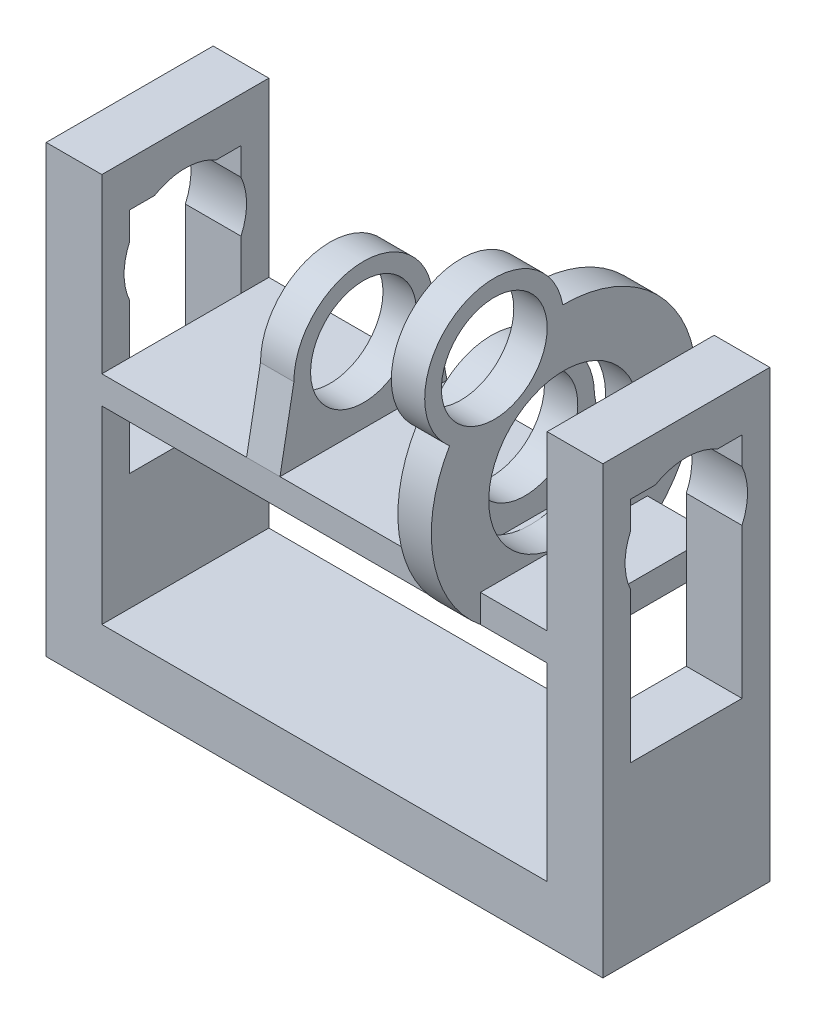
from build123d import *

# Parameters (mm, degrees)
CROQUIS1_W              = 80
CROQUIS1_H              = 34
SALIENTE_EXTRUIR1_DEPTH = 30
CROQUIS2_W              = 20
CROQUIS2_H              = 18
CORTAR_EXTRUIR1_DEPTH   = 30
CORTAR_EXTRUIR2_START   = 100
CROQUIS2_4_R            = 11
CROQUIS2_4_W            = 20
CROQUIS2_4_H            = 41
CORTAR_EXTRUIR2_DEPTH   = 20
SALIENTE_EXTRUIR2_START = 32
SALIENTE_EXTRUIR2_DEPTH = 6
SALIENTE_EXTRUIR3_START = 61
SALIENTE_EXTRUIR3_DEPTH = 6
SALIENTE_EXTRUIR4_START = -28
SALIENTE_EXTRUIR4_DEPTH = 6


# Read off the part's stored shape, not the designer's step: Saliente-Extruir4
with BuildPart() as part:
    # Croquis1 → Saliente-Extruir1 (new body)
    with BuildSketch(Plane.XY):
        Polygon((0, 80), (0, 0), (100, 0), (100, 80), (90, 80), (90, 49), (10, 49), (10, 80), align=None)
        with Locations((50, 27)):
            Rectangle(CROQUIS1_W, CROQUIS1_H, mode=Mode.SUBTRACT)
    extrude(amount=SALIENTE_EXTRUIR1_DEPTH)

    # Croquis2 → Cortar-Extruir1 (cut)
    with BuildSketch(Plane(origin=(10, 0, 0), x_dir=(0, 0, -1), z_dir=(1, 0, 0))):
        with BuildLine():
            Line((-20.545268253, 72), (-25, 72))
            Line((-25, 72), (-25, 67.082575695))
            ThreePointArc((-25, 67.082575695), (-23.152245501, 69.885180654), (-20.545268253, 72))
        make_face()
        with BuildLine():
            ThreePointArc((-9.454731747, 72), (-15, 73.5), (-20.545268253, 72))
            Line((-20.545268253, 72), (-9.454731747, 72))
        make_face()
        with BuildLine():
            Line((-5, 72), (-9.454731747, 72))
            ThreePointArc((-9.454731747, 72), (-6.847754499, 69.885180654), (-5, 67.082575695))
            Line((-5, 67.082575695), (-5, 72))
        make_face()
        with BuildLine():
            ThreePointArc((-4, 62.5), (-4.25290737, 64.84520788), (-5, 67.082575695))
            Line((-5, 67.082575695), (-5, 62.5))
            Line((-5, 62.5), (-4, 62.5))
        make_face()
        with BuildLine():
            Line((-4, 62.5), (-5, 62.5))
            Line((-5, 62.5), (-5, 57.917424305))
            ThreePointArc((-5, 57.917424305), (-4.25290737, 60.15479212), (-4, 62.5))
        make_face()
        with BuildLine():
            Line((-25, 62.5), (-25, 67.082575695))
            ThreePointArc((-25, 67.082575695), (-25.74709263, 64.84520788), (-26, 62.5))
            Line((-26, 62.5), (-25, 62.5))
        make_face()
        with BuildLine():
            Line((-25, 57.917424305), (-25, 62.5))
            Line((-25, 62.5), (-26, 62.5))
            ThreePointArc((-26, 62.5), (-25.74709263, 60.15479212), (-25, 57.917424305))
        make_face()
        with BuildLine():
            Line((-9.454731747, 72), (-20.545268253, 72))
            ThreePointArc((-20.545268253, 72), (-23.152245501, 69.885180654), (-25, 67.082575695))
            Line((-25, 67.082575695), (-25, 62.5))
            Line((-25, 62.5), (-5, 62.5))
            Line((-5, 62.5), (-5, 67.082575695))
            ThreePointArc((-5, 67.082575695), (-6.847754499, 69.885180654), (-9.454731747, 72))
        make_face()
        with BuildLine():
            Line((-5, 62.5), (-25, 62.5))
            Line((-25, 62.5), (-25, 57.917424305))
            ThreePointArc((-25, 57.917424305), (-15, 51.5), (-5, 57.917424305))
            Line((-5, 57.917424305), (-5, 62.5))
        make_face()
        with BuildLine():
            ThreePointArc((-5, 57.917424305), (-15, 51.5), (-25, 57.917424305))
            Line((-25, 57.917424305), (-25, 49))
            Line((-25, 49), (-5, 49))
            Line((-5, 49), (-5, 57.917424305))
        make_face()
        with Locations((-15, 40)):
            Rectangle(CROQUIS2_W, CROQUIS2_H)
    extrude(amount=-CORTAR_EXTRUIR1_DEPTH, mode=Mode.SUBTRACT)

    # Croquis2<4> → Cortar-Extruir2 (cut)
    with BuildSketch(Plane(origin=(10, 0, 0), x_dir=(0, 0, -1), z_dir=(1, 0, 0)).offset(CORTAR_EXTRUIR2_START)):
        with Locations((-15, 62.5)):
            Circle(CROQUIS2_4_R)
        with Locations((-15, 51.5)):
            Rectangle(CROQUIS2_4_W, CROQUIS2_4_H)
    extrude(amount=-CORTAR_EXTRUIR2_DEPTH, mode=Mode.SUBTRACT)

    # Croquis3 → Saliente-Extruir2 (add)
    with BuildSketch(Plane(origin=(10, 0, 0), x_dir=(0, 0, -1), z_dir=(1, 0, 0)).offset(SALIENTE_EXTRUIR2_START)):
        with BuildLine():
            Line((-15, 49), (-15, 50))
            ThreePointArc((-15, 50), (-20.590169944, 51.319660113), (-25, 55))
            Line((-25, 55), (-25, 49))
            Line((-25, 49), (-15, 49))
        make_face()
        with BuildLine():
            ThreePointArc((-5, 55), (-9.409830056, 51.319660113), (-15, 50))
            Line((-15, 50), (-15, 49))
            Line((-15, 49), (-5, 49))
            Line((-5, 49), (-5, 55))
        make_face()
        with BuildLine():
            Line((0, 49), (-2.5, 62.5))
            ThreePointArc((-2.5, 62.5), (-3.141458774, 58.547152925), (-5, 55))
            Line((-5, 55), (-5, 49))
            Line((-5, 49), (0, 49))
        make_face()
        with BuildLine():
            ThreePointArc((-25, 55), (-26.858541226, 58.547152925), (-27.5, 62.5))
            Line((-27.5, 62.5), (-30, 49))
            Line((-30, 49), (-25, 49))
            Line((-25, 49), (-25, 55))
        make_face()
        with BuildLine():
            Line((-15, 72), (-15, 73.5))
            ThreePointArc((-15, 73.5), (-17.872281323, 73.118380291), (-20.545268253, 72))
            Line((-20.545268253, 72), (-23.124038405, 72))
            ThreePointArc((-23.124038405, 72), (-24.117027587, 71.051596809), (-25, 70))
            Line((-25, 70), (-25, 67.082575695))
            ThreePointArc((-25, 67.082575695), (-26, 62.5), (-25, 57.917424305))
            Line((-25, 57.917424305), (-25, 55))
            ThreePointArc((-25, 55), (-20.590169944, 51.319660113), (-15, 50))
            Line((-15, 50), (-15, 53))
            ThreePointArc((-15, 53), (-24.5, 62.5), (-15, 72))
        make_face()
        with BuildLine():
            Line((-25, 67.082575695), (-25, 70))
            ThreePointArc((-25, 70), (-26.858541226, 66.452847075), (-27.5, 62.5))
            ThreePointArc((-27.5, 62.5), (-26.858541226, 58.547152925), (-25, 55))
            Line((-25, 55), (-25, 57.917424305))
            ThreePointArc((-25, 57.917424305), (-26, 62.5), (-25, 67.082575695))
        make_face()
        with BuildLine():
            ThreePointArc((-9.454731747, 72), (-12.127718677, 73.118380291), (-15, 73.5))
            Line((-15, 73.5), (-15, 72))
            ThreePointArc((-15, 72), (-8.282485579, 69.217514421), (-5.5, 62.5))
            ThreePointArc((-5.5, 62.5), (-8.282485579, 55.782485579), (-15, 53))
            Line((-15, 53), (-15, 50))
            ThreePointArc((-15, 50), (-9.409830056, 51.319660113), (-5, 55))
            Line((-5, 55), (-5, 57.917424305))
            ThreePointArc((-5, 57.917424305), (-4, 62.5), (-5, 67.082575695))
            Line((-5, 67.082575695), (-5, 70))
            ThreePointArc((-5, 70), (-5.882972413, 71.051596809), (-6.875961595, 72))
            Line((-6.875961595, 72), (-9.454731747, 72))
        make_face()
        with BuildLine():
            ThreePointArc((-2.5, 62.5), (-3.141458774, 66.452847075), (-5, 70))
            Line((-5, 70), (-5, 67.082575695))
            ThreePointArc((-5, 67.082575695), (-4, 62.5), (-5, 57.917424305))
            Line((-5, 57.917424305), (-5, 55))
            ThreePointArc((-5, 55), (-3.141458774, 58.547152925), (-2.5, 62.5))
        make_face()
        with BuildLine():
            ThreePointArc((-6.875961595, 72), (-10.669872981, 74.2260394), (-15, 75))
            Line((-15, 75), (-15, 73.5))
            ThreePointArc((-15, 73.5), (-12.127718677, 73.118380291), (-9.454731747, 72))
            Line((-9.454731747, 72), (-6.875961595, 72))
        make_face()
        with BuildLine():
            Line((-15, 73.5), (-15, 75))
            ThreePointArc((-15, 75), (-19.330127019, 74.2260394), (-23.124038405, 72))
            Line((-23.124038405, 72), (-20.545268253, 72))
            ThreePointArc((-20.545268253, 72), (-17.872281323, 73.118380291), (-15, 73.5))
        make_face()
    extrude(amount=-SALIENTE_EXTRUIR2_DEPTH)

    # Croquis3<3> → Saliente-Extruir3 (add)
    with BuildSketch(Plane(origin=(10, 0, 0), x_dir=(0, 0, -1), z_dir=(1, 0, 0)).offset(SALIENTE_EXTRUIR3_START)):
        with BuildLine():
            Line((0, 49), (-2.5, 62.5))
            ThreePointArc((-2.5, 62.5), (-3.141458774, 58.547152925), (-5, 55))
            Line((-5, 55), (-5, 49))
            Line((-5, 49), (0, 49))
        make_face()
        with BuildLine():
            ThreePointArc((-5, 55), (-9.409830056, 51.319660113), (-15, 50))
            Line((-15, 50), (-15, 49))
            Line((-15, 49), (-5, 49))
            Line((-5, 49), (-5, 55))
        make_face()
        with BuildLine():
            ThreePointArc((-2.5, 62.5), (-3.141458774, 66.452847075), (-5, 70))
            Line((-5, 70), (-5, 67.082575695))
            ThreePointArc((-5, 67.082575695), (-4, 62.5), (-5, 57.917424305))
            Line((-5, 57.917424305), (-5, 55))
            ThreePointArc((-5, 55), (-3.141458774, 58.547152925), (-2.5, 62.5))
        make_face()
        with BuildLine():
            ThreePointArc((-9.454731747, 72), (-12.127718677, 73.118380291), (-15, 73.5))
            Line((-15, 73.5), (-15, 72))
            ThreePointArc((-15, 72), (-8.282485579, 69.217514421), (-5.5, 62.5))
            ThreePointArc((-5.5, 62.5), (-8.282485579, 55.782485579), (-15, 53))
            Line((-15, 53), (-15, 50))
            ThreePointArc((-15, 50), (-9.409830056, 51.319660113), (-5, 55))
            Line((-5, 55), (-5, 57.917424305))
            ThreePointArc((-5, 57.917424305), (-4, 62.5), (-5, 67.082575695))
            Line((-5, 67.082575695), (-5, 70))
            ThreePointArc((-5, 70), (-5.882972413, 71.051596809), (-6.875961595, 72))
            Line((-6.875961595, 72), (-9.454731747, 72))
        make_face()
        with BuildLine():
            Line((-15, 72), (-15, 73.5))
            ThreePointArc((-15, 73.5), (-17.872281323, 73.118380291), (-20.545268253, 72))
            Line((-20.545268253, 72), (-23.124038405, 72))
            ThreePointArc((-23.124038405, 72), (-24.117027587, 71.051596809), (-25, 70))
            Line((-25, 70), (-25, 67.082575695))
            ThreePointArc((-25, 67.082575695), (-26, 62.5), (-25, 57.917424305))
            Line((-25, 57.917424305), (-25, 55))
            ThreePointArc((-25, 55), (-20.590169944, 51.319660113), (-15, 50))
            Line((-15, 50), (-15, 53))
            ThreePointArc((-15, 53), (-24.5, 62.5), (-15, 72))
        make_face()
        with BuildLine():
            Line((-15, 49), (-15, 50))
            ThreePointArc((-15, 50), (-20.590169944, 51.319660113), (-25, 55))
            Line((-25, 55), (-25, 49))
            Line((-25, 49), (-15, 49))
        make_face()
        with BuildLine():
            ThreePointArc((-25, 55), (-26.858541226, 58.547152925), (-27.5, 62.5))
            Line((-27.5, 62.5), (-30, 49))
            Line((-30, 49), (-25, 49))
            Line((-25, 49), (-25, 55))
        make_face()
        with BuildLine():
            Line((-25, 67.082575695), (-25, 70))
            ThreePointArc((-25, 70), (-26.858541226, 66.452847075), (-27.5, 62.5))
            ThreePointArc((-27.5, 62.5), (-26.858541226, 58.547152925), (-25, 55))
            Line((-25, 55), (-25, 57.917424305))
            ThreePointArc((-25, 57.917424305), (-26, 62.5), (-25, 67.082575695))
        make_face()
        with BuildLine():
            Line((-15, 73.5), (-15, 75))
            ThreePointArc((-15, 75), (-19.330127019, 74.2260394), (-23.124038405, 72))
            Line((-23.124038405, 72), (-20.545268253, 72))
            ThreePointArc((-20.545268253, 72), (-17.872281323, 73.118380291), (-15, 73.5))
        make_face()
        with BuildLine():
            ThreePointArc((-6.875961595, 72), (-10.669872981, 74.2260394), (-15, 75))
            Line((-15, 75), (-15, 73.5))
            ThreePointArc((-15, 73.5), (-12.127718677, 73.118380291), (-9.454731747, 72))
            Line((-9.454731747, 72), (-6.875961595, 72))
        make_face()
    extrude(amount=-SALIENTE_EXTRUIR3_DEPTH)

    # Saliente-Extruir4 outline → Saliente-Extruir4 (add)
    with BuildSketch(Plane(origin=(100, 0, 0), x_dir=(0, 0, -1), z_dir=(1, 0, 0)).offset(SALIENTE_EXTRUIR4_START)):
        with BuildLine():
            Line((0, 49), (0, 44))
            ThreePointArc((0, 44), (6.500060011, 52.253175148), (8.817010728, 62.5))
            ThreePointArc((8.817010728, 62.5), (1.774205668, 79.407868707), (-15.189026595, 86.3162606))
            ThreePointArc((-15.189026595, 86.3162606), (-15.047346316, 85.237564817), (-15, 84.150635095))
            ThreePointArc((-15, 84.150635095), (-15.886469538, 79.527226156), (-18.420145635, 75.559579007))
            ThreePointArc((-18.420145635, 75.559579007), (-6.751423337, 73.186953871), (-1.5, 62.5))
            ThreePointArc((-1.5, 62.5), (-5.454058454, 52.954058454), (-15, 49))
            Line((-15, 49), (0, 49))
        make_face()
        with BuildLine():
            ThreePointArc((-35.530973405, 74.571832133), (-38.436547266, 58.259923086), (-30, 44))
            Line((-30, 44), (-30, 49))
            Line((-30, 49), (-30, 71.903186381))
            ThreePointArc((-30, 71.903186381), (-32.931921184, 72.892561003), (-35.530973405, 74.571832133))
        make_face()
        with BuildLine():
            ThreePointArc((-33.837691475, 77.073653622), (-34.724039173, 75.849617174), (-35.530973405, 74.571832133))
            ThreePointArc((-35.530973405, 74.571832133), (-32.931921184, 72.892561003), (-30, 71.903186381))
            Line((-30, 71.903186381), (-30, 74.985483705))
            ThreePointArc((-30, 74.985483705), (-32.040518809, 75.805954816), (-33.837691475, 77.073653622))
        make_face()
        with BuildLine():
            ThreePointArc((-15.189026595, 86.3162606), (-33.75, 94.975952642), (-35.530973405, 74.571832133))
            ThreePointArc((-35.530973405, 74.571832133), (-34.724039173, 75.849617174), (-33.837691475, 77.073653622))
            ThreePointArc((-33.837691475, 77.073653622), (-32.25, 92.377876431), (-18.202308525, 86.100746177))
            ThreePointArc((-18.202308525, 86.100746177), (-16.699088017, 86.256327576), (-15.189026595, 86.3162606))
        make_face()
        with BuildLine():
            Line((-30, 71.903186381), (-30, 49))
            Line((-30, 49), (-15, 49))
            ThreePointArc((-15, 49), (-27.457693483, 57.298473967), (-24.599854366, 71.991722508))
            ThreePointArc((-24.599854366, 71.991722508), (-27.295088327, 71.652314759), (-30, 71.903186381))
        make_face()
        with BuildLine():
            ThreePointArc((-15, 84.150635095), (-15.047346316, 85.237564817), (-15.189026595, 86.3162606))
            ThreePointArc((-15.189026595, 86.3162606), (-16.699088017, 86.256327576), (-18.202308525, 86.100746177))
            ThreePointArc((-18.202308525, 86.100746177), (-18.050712487, 85.130923569), (-18, 84.150635095))
            ThreePointArc((-18, 84.150635095), (-21.733718703, 76.600800659), (-30, 74.985483705))
            Line((-30, 74.985483705), (-30, 71.903186381))
            ThreePointArc((-30, 71.903186381), (-27.295088327, 71.652314759), (-24.599854366, 71.991722508))
            ThreePointArc((-24.599854366, 71.991722508), (-21.75, 74.191342951), (-18.420145635, 75.559579007))
            ThreePointArc((-18.420145635, 75.559579007), (-15.886469538, 79.527226156), (-15, 84.150635095))
        make_face()
    extrude(amount=SALIENTE_EXTRUIR4_DEPTH)


solid = part.part
